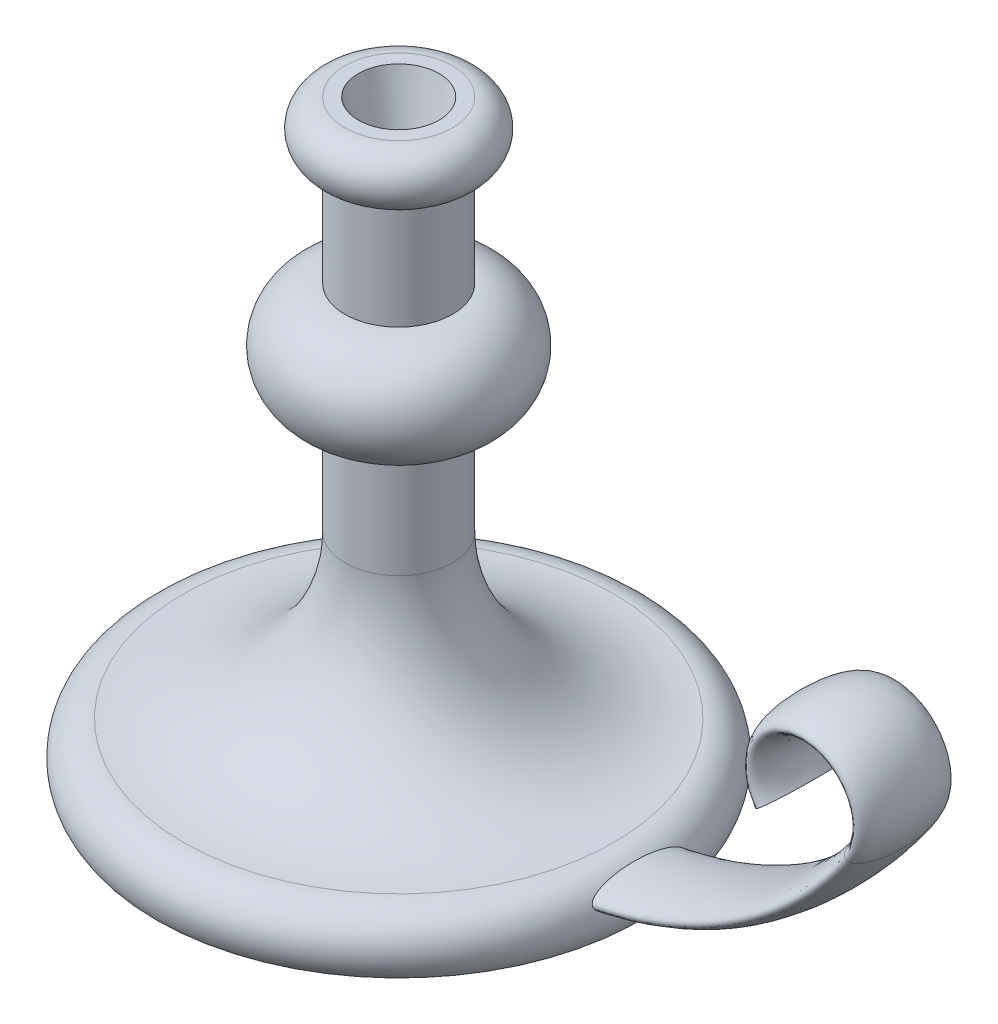
from build123d import *

# Parameters (mm, degrees)
SKETCH3_RX         = 17.5
SKETCH3_RY         = 5
SKETCH4_R          = 15
CUT_EXTRUDE1_DEPTH = 25
CUT_EXTRUDE1_DRAFT = -15


with BuildPart() as part:
    # Sketch1 → Revolve1 (revolve)
    with BuildSketch(Plane.XY):
        with BuildLine():
            Line((0, 0), (0, 220))
            Line((0, 220), (20, 220))
            ThreePointArc((20, 220), (30, 210), (20, 200))
            Line((20, 200), (20, 160))
            ThreePointArc((20, 160), (40, 140), (20, 120))
            Line((20, 120), (20, 80))
            ThreePointArc((20, 80), (37.573593129, 37.573593129), (80, 20))
            ThreePointArc((80, 20), (91.180339887, 13.090169944), (90, 0))
            Line((90, 0), (0, 0))
        make_face()
    revolve(axis=Axis((0, 0, 0), (0, 1, 0)))

    # Sweep1: sweep along a path in Sketch2
    with BuildLine(Plane.XY) as sweep1_path:
        Line((0, 10), (60, 10))
        ThreePointArc((60, 10), (129.821200219, 27.240819526), (183.592070943, 75))
        ThreePointArc((183.592070943, 75), (167.113128151, 106.333333333), (150.634185358, 75))
    # Sketch3 → Sweep1 (sweep)
    with BuildSketch(Plane(origin=(0, 0, 0), x_dir=(0, 0, -1), z_dir=(1, 0, 0))):
        with Locations((0, 10)):
            Ellipse(SKETCH3_RX, SKETCH3_RY)
    sweep(path=sweep1_path.line)


with BuildPart() as cut_extrude1_tool:
    # Sketch4 → Cut-Extrude1 (with draft: the straight prism first)
    with BuildSketch(Plane(origin=(0, 220, 0), x_dir=(1, 0, 0), z_dir=(0, 1, 0))):
        Circle(SKETCH4_R)
    extrude(amount=-CUT_EXTRUDE1_DEPTH)
    # Cut-Extrude1: the draft: its side faces are tilted about the plane it starts from
    cut_extrude1_sides = [cut_extrude1_tool.faces().sort_by_distance(p)[0] for p in [
        (-15, 207.5, 0),
    ]]
    draft(cut_extrude1_sides, Plane(origin=(0, 220, 0), x_dir=(1, 0, 0), z_dir=(0, 1, 0)), CUT_EXTRUDE1_DRAFT)


with BuildPart() as part_1:
    add(part.part)

    # Cut-Extrude1: cut by cut_extrude1_tool
    add(cut_extrude1_tool.part, mode=Mode.SUBTRACT)


solid = part_1.part
